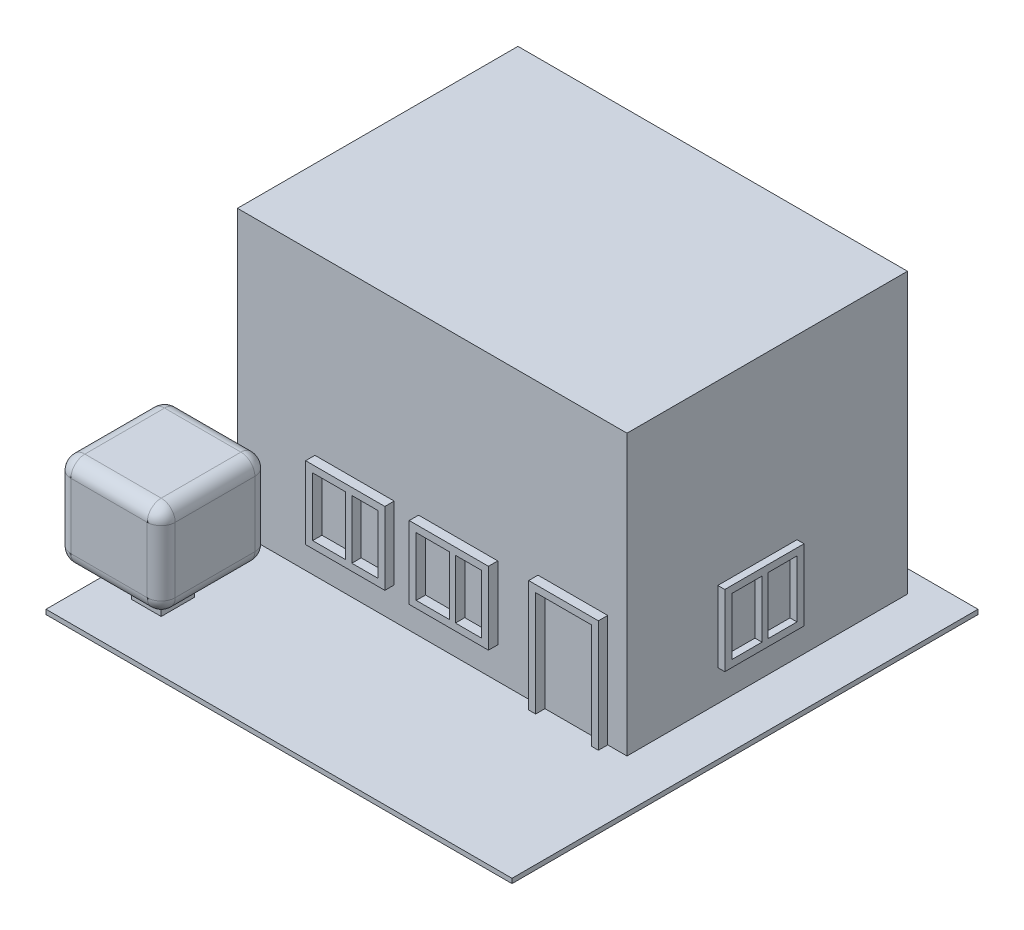
from build123d import *

# Parameters (mm, degrees)
ESBO_O1_W                 = 1
ESBO_O1_H                 = 1
RESSALTO_EXTRUS_O1_DEPTH  = 0.01
ESBO_O2_W                 = 0.835884883
ESBO_O2_H                 = 0.601923969
RESSALTO_EXTRUS_O3_DEPTH  = 0.3
ESBO_O8_W                 = 0.17
ESBO_O8_H                 = 0.1527975
ESBO_O8_W_2               = 0.064789378
ESBO_O8_H_2               = 0.1227975
ESBO_O8_W_3               = 0.0620701
RESSALTO_EXTRUS_O7_DEPTH  = 0.015
ESBO_O7_W                 = 0.17
ESBO_O7_H                 = 0.1527975
ESBO_O7_W_2               = 0.064789378
ESBO_O7_H_2               = 0.1227975
ESBO_O7_W_3               = 0.0620701
RESSALTO_EXTRUS_O8_DEPTH  = 0.015
ESBO_O9_W                 = 0.063807516
ESBO_O9_H                 = 0.071007721
RESSALTO_EXTRUS_O10_DEPTH = 0.07
ESBO_O11_W                = 0.223807516
ESBO_O11_H                = 0.231007721
RESSALTO_EXTRUS_O11_DEPTH = 0.2
FILETE2_R                 = 0.03
FILETE3_R                 = 0.03
ESBO_O6_W                 = 0.17
ESBO_O6_H                 = 0.15594777
ESBO_O6_W_2               = 0.055847654
ESBO_O6_H_2               = 0.12594777
ESBO_O6_W_3               = 0.071011824
ESBO_O6_W_4               = 0.055847655
ESBO_O6_W_5               = 0.071011823
RESSALTO_EXTRUS_O12_DEPTH = 0.02
ESBO_O12_W                = 0.835884883
ESBO_O12_H                = 0.601923969
RESSALTO_EXTRUS_O13_DEPTH = 0.3


with BuildPart() as part:
    # Esboço1 → Ressalto-extrusão1 (new body)
    with BuildSketch(Plane(origin=(0, 0, 0), x_dir=(1, 0, 0), z_dir=(0, 1, 0))):
        Rectangle(ESBO_O1_W, ESBO_O1_H)
    extrude(amount=RESSALTO_EXTRUS_O1_DEPTH)

    # Esboço2 → Ressalto-extrusão3 (add)
    with BuildSketch(Plane(origin=(0, 0.01, 0), x_dir=(1, 0, 0), z_dir=(0, 1, 0))):
        with Locations((-0.021781552, 0.151543531)):
            Rectangle(ESBO_O2_W, ESBO_O2_H)
    extrude(amount=RESSALTO_EXTRUS_O3_DEPTH)

    # Esboço8 → Ressalto-extrusão7 (add)
    with BuildSketch(Plane(origin=(0.396160889, 0, 0), x_dir=(0, 0, -1), z_dir=(1, 0, 0))):
        with Locations((0.130456206, 0.153176171)):
            Rectangle(ESBO_O8_W, ESBO_O8_H)
        with Locations((0.092850895, 0.153176171)):
            Rectangle(ESBO_O8_W_2, ESBO_O8_H_2, mode=Mode.SUBTRACT)
        with Locations((0.169421156, 0.153176171)):
            Rectangle(ESBO_O8_W_3, ESBO_O8_H_2, mode=Mode.SUBTRACT)
    extrude(amount=RESSALTO_EXTRUS_O7_DEPTH)

    # Esboço7 → Ressalto-extrusão8 (add)
    with BuildSketch(Plane.ZY.offset(0.439723994)):
        with Locations((-0.158153325, 0.157477131)):
            Rectangle(ESBO_O7_W, ESBO_O7_H)
        with Locations((-0.195758636, 0.157477131)):
            Rectangle(ESBO_O7_W_2, ESBO_O7_H_2, mode=Mode.SUBTRACT)
        with Locations((-0.119188375, 0.157477131)):
            Rectangle(ESBO_O7_W_3, ESBO_O7_H_2, mode=Mode.SUBTRACT)
    extrude(amount=RESSALTO_EXTRUS_O8_DEPTH)

    # Esboço9 → Ressalto-extrusão10 (add)
    with BuildSketch(Plane(origin=(0, 0.01, 0), x_dir=(1, 0, 0), z_dir=(0, 1, 0))):
        with Locations((-0.394760136, -0.354413696)):
            Rectangle(ESBO_O9_W, ESBO_O9_H)
    extrude(amount=RESSALTO_EXTRUS_O10_DEPTH)

    # Esboço11 → Ressalto-extrusão11 (add)
    with BuildSketch(Plane(origin=(0, 0.08, 0), x_dir=(1, 0, 0), z_dir=(0, 1, 0))):
        with Locations((-0.394760136, -0.354413696)):
            Rectangle(ESBO_O11_W, ESBO_O11_H)
    extrude(amount=RESSALTO_EXTRUS_O11_DEPTH)

    # Filete2
    filete2_edges = [part.edges().sort_by_distance(p)[0] for p in [
        (-0.506663894, 0.08, 0.354413695),
        (-0.506663894, 0.18, 0.238909835),
        (-0.394760136, 0.08, 0.469917556),
        (-0.506663894, 0.18, 0.469917556),
        (-0.282856378, 0.18, 0.469917556),
        (-0.394760136, 0.28, 0.238909835),
        (-0.506663894, 0.28, 0.354413695),
        (-0.394760136, 0.28, 0.469917556),
        (-0.282856378, 0.28, 0.354413695),
    ]]
    fillet(filete2_edges, radius=FILETE2_R)

    # Filete3
    # the kernel refuses this fillet: 0.03 mm, written as the material it takes off along each edge
    with BuildSketch(Plane(origin=(-0.476663894, 0.11, 0.268909835), x_dir=(0, 0, -1), z_dir=(0, -1, 0))) as filete3_piece_1_section:
        Polygon((0, 0), (FILETE3_R, 0), (FILETE3_R, -FILETE3_R), (0, -FILETE3_R), align=None)
    filete3_piece_1 = extrude(amount=FILETE3_R, mode=Mode.PRIVATE)
    filete3_piece_1 = filete3_piece_1 - Plane(origin=(-0.476663894, 0.11, 0.268909835), x_dir=(0.7071067811865475, 0, 0.7071067811865475), z_dir=(0, -1, 0)) * Sphere(FILETE3_R, mode=Mode.PRIVATE)
    add(filete3_piece_1, mode=Mode.SUBTRACT)
    with BuildSketch(Plane(origin=(-0.312856378, 0.25, 0.268909835), x_dir=(1, 0, 0), z_dir=(0, 0, -1))) as filete3_piece_2_section:
        Polygon((0, 0), (FILETE3_R, 0), (FILETE3_R, -FILETE3_R), (0, -FILETE3_R), align=None)
    filete3_piece_2 = extrude(amount=FILETE3_R, mode=Mode.PRIVATE)
    filete3_piece_2 = filete3_piece_2 - Plane(origin=(-0.312856378, 0.25, 0.268909835), x_dir=(-0.7071067811865475, -0.7071067811865475, 0), z_dir=(0, 0, -1)) * Sphere(FILETE3_R, mode=Mode.PRIVATE)
    add(filete3_piece_2, mode=Mode.SUBTRACT)
    with BuildSketch(Plane(origin=(-0.312856378, 0.11, 0.439917556), x_dir=(1, 0, 0), z_dir=(0, -1, 0))) as filete3_piece_3_section:
        Polygon((0, 0), (FILETE3_R, 0), (FILETE3_R, FILETE3_R), (0, FILETE3_R), align=None)
    filete3_piece_3 = extrude(amount=FILETE3_R, mode=Mode.PRIVATE)
    filete3_piece_3 = filete3_piece_3 - Plane(origin=(-0.312856378, 0.11, 0.439917556), x_dir=(-0.7071067811865475, 0, -0.7071067811865475), z_dir=(0, -1, 0)) * Sphere(FILETE3_R, mode=Mode.PRIVATE)
    add(filete3_piece_3, mode=Mode.SUBTRACT)
    with BuildSketch(Plane(origin=(-0.312856378, 0.11, 0.268909835), x_dir=(0, -1, 0), z_dir=(1, 0, 0))) as filete3_piece_4_section:
        Polygon((0, 0), (FILETE3_R, 0), (FILETE3_R, FILETE3_R), (0, FILETE3_R), align=None)
    filete3_piece_4 = extrude(amount=FILETE3_R, mode=Mode.PRIVATE)
    filete3_piece_4 = filete3_piece_4 - Plane(origin=(-0.312856378, 0.11, 0.268909835), x_dir=(0, 0.7071067811865475, 0.7071067811865475), z_dir=(1, 0, 0)) * Sphere(FILETE3_R, mode=Mode.PRIVATE)
    add(filete3_piece_4, mode=Mode.SUBTRACT)
    with BuildSketch(Plane(origin=(-0.312856378, 0.08, 0.238909835), x_dir=(0, 0, 1), z_dir=(-1, 0, 0))) as filete3_piece_5:
        with BuildLine():
            CenterArc((FILETE3_R, FILETE3_R), FILETE3_R, 180, 90)
            Line((0, FILETE3_R), (0, 0))
            Line((0, 0), (FILETE3_R, 0))
        make_face()
    extrude(amount=0.163807516, mode=Mode.SUBTRACT)
    with BuildSketch(Plane(origin=(-0.282856378, 0.08, 0.439917556), x_dir=(-1, 0, 0), z_dir=(0, 0, -1))) as filete3_piece_6:
        with BuildLine():
            CenterArc((FILETE3_R, FILETE3_R), FILETE3_R, 180, 90)
            Line((0, FILETE3_R), (0, 0))
            Line((0, 0), (FILETE3_R, 0))
        make_face()
    extrude(amount=0.171007722, mode=Mode.SUBTRACT)
    with BuildSketch(Plane(origin=(-0.282856378, 0.11, 0.238909835), x_dir=(-1, 0, 0), z_dir=(0, 1, 0))) as filete3_piece_7:
        with BuildLine():
            CenterArc((FILETE3_R, FILETE3_R), FILETE3_R, 180, 90)
            Line((0, FILETE3_R), (0, 0))
            Line((0, 0), (FILETE3_R, 0))
        make_face()
    extrude(amount=0.14, mode=Mode.SUBTRACT)

    # Esboço6 → Ressalto-extrusão12 (add)
    # profile 1 of 3: a face of its own
    with BuildSketch(Plane.XY.offset(0.149418454)):
        with Locations((0.033883439, 0.156046001)):
            Rectangle(ESBO_O6_W, ESBO_O6_H)
        with Locations((0.075959612, 0.156046001)):
            Rectangle(ESBO_O6_W_2, ESBO_O6_H_2, mode=Mode.SUBTRACT)
        with Locations((-0.000610649, 0.156046001)):
            Rectangle(ESBO_O6_W_3, ESBO_O6_H_2, mode=Mode.SUBTRACT)
    # profile 2 of 3: a face of its own
    with BuildSketch(Plane.XY.offset(0.149418454)):
        Polygon((0.205177687, 0.01), (0.220177687, 0.01), (0.220177687, 0.235633321), (0.339843806, 0.235633321), (0.339843806, 0.01), (0.354843806, 0.01), (0.354843806, 0.250633321), (0.205177687, 0.250633321), align=None)
    # profile 3 of 3: a face of its own
    with BuildSketch(Plane.XY.offset(0.149418454)):
        with Locations((-0.188447602, 0.156046001)):
            Rectangle(ESBO_O6_W, ESBO_O6_H)
        with Locations((-0.14637143, 0.156046001)):
            Rectangle(ESBO_O6_W_4, ESBO_O6_H_2, mode=Mode.SUBTRACT)
        with Locations((-0.222941691, 0.156046001)):
            Rectangle(ESBO_O6_W_5, ESBO_O6_H_2, mode=Mode.SUBTRACT)
    extrude(amount=RESSALTO_EXTRUS_O12_DEPTH)

    # Esboço12 → Ressalto-extrusão13 (add)
    with BuildSketch(Plane(origin=(0, 0.31, 0), x_dir=(1, 0, 0), z_dir=(0, 1, 0))):
        with Locations((-0.021781552, 0.151543531)):
            Rectangle(ESBO_O12_W, ESBO_O12_H)
    extrude(amount=RESSALTO_EXTRUS_O13_DEPTH)


solid = part.part
